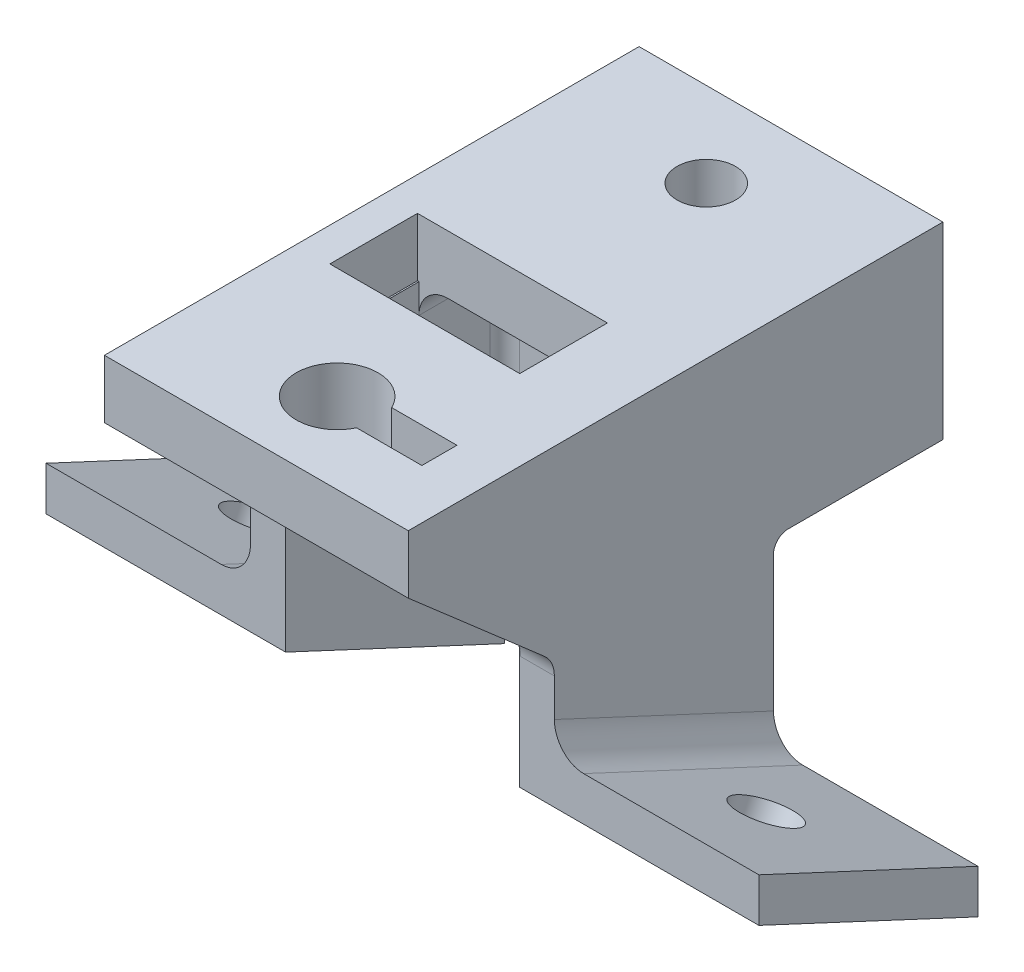
from build123d import *

# Parameters (mm, degrees)
SKETCH1_W           = 26.416
SKETCH1_H           = 31.75
BOSS_EXTRUDE1_DEPTH = 5.08
SKETCH2_W           = 16.51
SKETCH2_H           = 7.62
CUT_EXTRUDE1_DEPTH  = 5.08
BOSS_EXTRUDE2_DEPTH = 26.416
BOSS_EXTRUDE3_DEPTH = 2.921
BOSS_EXTRUDE4_DEPTH = 2.921
BOSS_EXTRUDE5_DEPTH = 17.78
BOSS_EXTRUDE6_DEPTH = 17.78
SKETCH10_R          = 2.54
CUT_EXTRUDE3_DEPTH  = 17.78
SKETCH11_W          = 20.32
SKETCH11_H          = 30.981160888
CUT_EXTRUDE4_DEPTH  = 22.86
FILLET3_R           = 2.54
FILLET4_R           = 2.54
SKETCH12_W          = 26.416
SKETCH12_H          = 14.732
SKETCH12_R          = 2.54
BOSS_EXTRUDE7_DEPTH = 16.383
FILLET5_R           = 1.27
FILLET6_R           = 1.27


with BuildPart() as part:
    # Sketch1 → Boss-Extrude1 (new body)
    with BuildSketch(Plane(origin=(0, 0, 0), x_dir=(1, 0, 0), z_dir=(0, 1, 0))):
        with Locations((2.032, 9.525)):
            Rectangle(SKETCH1_W, SKETCH1_H)
        with BuildLine():
            ThreePointArc((5.244874103, -0.8509), (-1.524, 0.6731), (5.244874103, 2.1971))
            Line((5.244874103, 2.1971), (10.922, 2.1971))
            Line((10.922, 2.1971), (10.922, -0.8509))
            Line((10.922, -0.8509), (5.244874103, -0.8509))
        make_face(mode=Mode.SUBTRACT)
    extrude(amount=BOSS_EXTRUDE1_DEPTH)

    # Sketch2 → Cut-Extrude1 (cut)
    with BuildSketch(Plane(origin=(0, 5.08, 0), x_dir=(1, 0, 0), z_dir=(0, 1, 0))):
        with Locations((0, 14.1351)):
            Rectangle(SKETCH2_W, SKETCH2_H)
    extrude(amount=-CUT_EXTRUDE1_DEPTH, mode=Mode.SUBTRACT)

    # Sketch3 → Boss-Extrude2 (add)
    with BuildSketch(Plane.ZY.offset(11.176)):
        Polygon((-25.4, -30.981160888), (-6.35, -22.098), (-6.35, 0), (-25.4, 0), align=None)
    extrude(amount=-BOSS_EXTRUDE2_DEPTH)

    # Sketch6 → Boss-Extrude3 (add)
    with BuildSketch(Plane.ZY.offset(11.176)):
        Polygon((6.35, 0), (-6.35, -11.049), (-6.35, 0), align=None)
    extrude(amount=-BOSS_EXTRUDE3_DEPTH)

    # Sketch7 → Boss-Extrude4 (add)
    with BuildSketch(Plane(origin=(15.24, 0, 0), x_dir=(0, 0, -1), z_dir=(1, 0, 0))):
        Polygon((-6.35, 0), (6.35, -11.049), (6.35, 0), align=None)
    extrude(amount=-BOSS_EXTRUDE4_DEPTH)

    # Sketch8 → Boss-Extrude5 (add)
    with BuildSketch(Plane(origin=(15.24, 0, 0), x_dir=(0, 0, -1), z_dir=(1, 0, 0))):
        Polygon((6.35, -22.098), (25.4, -30.981160888), (25.4, -27.171160888), (6.35, -18.288), align=None)
    extrude(amount=BOSS_EXTRUDE5_DEPTH)

    # Sketch9 → Boss-Extrude6 (add)
    with BuildSketch(Plane.ZY.offset(11.176)):
        Polygon((-6.35, -22.098), (-25.4, -30.981160888), (-25.4, -27.171160888), (-6.35, -18.288), align=None)
    extrude(amount=BOSS_EXTRUDE6_DEPTH)

    # Sketch10 → Cut-Extrude3 (cut)
    with BuildSketch(Plane(origin=(0, -12.589458796, 5.870561049), x_dir=(1, 0, 0), z_dir=(0, 0.9063077870366494, -0.42261826174070083))):
        with Locations((24.13, 23.993528218)):
            Circle(SKETCH10_R)
        with Locations((-20.066, 23.993528218)):
            Circle(SKETCH10_R)
    extrude(amount=-CUT_EXTRUDE3_DEPTH, mode=Mode.SUBTRACT)

    # Sketch11 → Cut-Extrude4 (cut)
    with BuildSketch(Plane(origin=(0, 0, -25.4), x_dir=(-1, 0, 0), z_dir=(0, 0, -1))):
        with Locations((-2.032, -15.490580444)):
            Rectangle(SKETCH11_W, SKETCH11_H)
    extrude(amount=-CUT_EXTRUDE4_DEPTH, mode=Mode.SUBTRACT)

    # Fillet3
    fillet3_edges = [part.edges().sort_by_distance(p)[0] for p in [
        (-8.128, 0, -8.33755),
        (-8.128, 0, -21.67255),
        (12.192, 0, -15.875),
        (15.24, -22.729580444, -15.875),
        (-11.176, -22.729580444, -15.875),
    ]]
    fillet(fillet3_edges, radius=FILLET3_R)

    # Fillet4
    fillet4_edges = [part.edges().sort_by_distance(p)[0] for p in [
        (-9.7155, -11.049, -6.35),
        (13.7795, -11.049, -6.35),
    ]]
    fillet(fillet4_edges, radius=FILLET4_R)

    # Sketch12 → Boss-Extrude7 (add)
    with BuildSketch(Plane(origin=(0, 5.08, 0), x_dir=(1, 0, 0), z_dir=(0, 1, 0))):
        with Locations((2.032, 32.766)):
            Rectangle(SKETCH12_W, SKETCH12_H)
        with Locations((2.032, 32.766)):
            Circle(SKETCH12_R, mode=Mode.SUBTRACT)
    extrude(amount=-BOSS_EXTRUDE7_DEPTH)

    # Fillet5
    fillet5_edges = [part.edges().sort_by_distance(p)[0] for p in [
        (-8.128, -6.9215, -25.4),
        (-7.384051224, -0.743948776, -25.4),
        (2.032, 0, -25.4),
        (11.448051224, -0.743948776, -25.4),
        (12.192, -6.9215, -25.4),
    ]]
    fillet(fillet5_edges, radius=FILLET5_R)

    # Fillet6
    fillet6_edges = [part.edges().sort_by_distance(p)[0] for p in [
        (-9.652, -11.303, -25.4),
        (13.716, -11.303, -25.4),
    ]]
    fillet(fillet6_edges, radius=FILLET6_R)


solid = part.part
